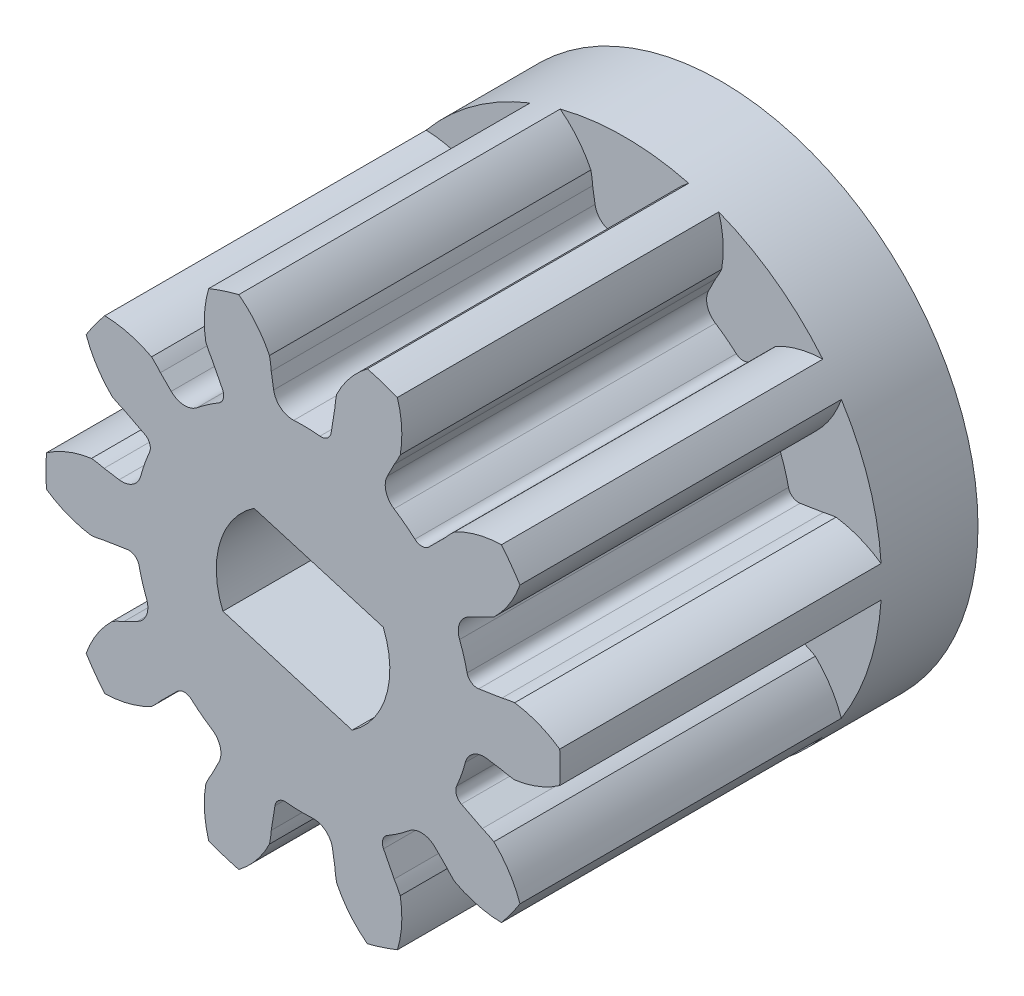
from build123d import *

# Parameters (mm, degrees)
ESBO_O1_R                = 8
RESSALTO_EXTRUS_O1_DEPTH = 13
CORTE_EXTRUS_O1_START    = -10
CORTE_EXTRUS_O1_DEPTH    = 10
PADR_OCIRCULAR1_COUNT    = 10
ESBO_O5_R                = 2.75
CORTE_EXTRUS_O2_DEPTH    = 2.5
FILETE1_R                = 1


with BuildPart() as part:
    # Esboço1 → Ressalto-extrusão1 (new body)
    with BuildSketch(Plane.XY.offset(-62.474592215)):
        with Locations(Location((154.344666384, -4.979841337, 0), (0, 0, 90))):
            Circle(ESBO_O1_R)
        with BuildLine():
            Line((156.839244486, -3.946845648), (152.817363907, -2.753331256))
            ThreePointArc((152.817363907, -2.753331256), (151.756235333, -4.211710693), (151.850088282, -6.012837026))
            Line((151.850088282, -6.012837026), (155.871968862, -7.206351418))
            ThreePointArc((155.871968862, -7.206351418), (156.933097439, -5.747971979), (156.839244486, -3.946845648))
        make_face(mode=Mode.SUBTRACT)
    extrude(amount=RESSALTO_EXTRUS_O1_DEPTH)

    # Esboço4 → Corte-extrusão1 (cut)
    with BuildSketch(Plane.XY.offset(-49.474592215).offset(CORTE_EXTRUS_O1_START)):
        with BuildLine():
            Line((155.259844023, -10.698578623), (155.334666384, -11.166126571))
            ThreePointArc((155.334666384, -11.166126571), (155.355864946, -11.365142474), (155.389666384, -11.562409225))
            ThreePointArc((155.389666384, -11.562409225), (155.798933371, -12.200119109), (156.344666384, -12.725808029))
            ThreePointArc((156.344666384, -12.725808029), (154.344666384, -12.979841337), (152.344666384, -12.725808029))
            ThreePointArc((152.344666384, -12.725808029), (152.890399398, -12.200119109), (153.299666384, -11.562409225))
            ThreePointArc((153.299666384, -11.562409225), (153.333467823, -11.365142474), (153.354666384, -11.166126571))
            Line((153.354666384, -11.166126571), (153.470297344, -10.443574954))
            ThreePointArc((153.470297344, -10.443574954), (153.591194582, -10.240482514), (153.8185158, -10.175769725))
            ThreePointArc((153.8185158, -10.175769725), (154.225958814, -10.20099205), (154.634127125, -10.194313384))
            ThreePointArc((154.634127125, -10.194313384), (155.043877847, -10.326217347), (155.259844023, -10.698578623))
        make_face()
    corte_extrus_o1 = extrude(amount=CORTE_EXTRUS_O1_DEPTH, mode=Mode.SUBTRACT)

    # PadrãoCircular1: Corte-extrusão1 ×10 about axis
    padr_ocircular1_axis = Axis((154.344666384, -4.979841337, 0), (0, 0, 1))
    for i in range(1, PADR_OCIRCULAR1_COUNT):
        add(corte_extrus_o1.rotate(padr_ocircular1_axis, i * 360 / PADR_OCIRCULAR1_COUNT), mode=Mode.SUBTRACT)

    # Esboço5 → Corte-extrusão2 (cut)
    with BuildSketch(Plane(origin=(0, 0, -62.474592215), x_dir=(-1, 0, 0), z_dir=(0, 0, -1))):
        with Locations((-154.344666384, -4.979841337)):
            Circle(ESBO_O5_R)
    extrude(amount=-CORTE_EXTRUS_O2_DEPTH, mode=Mode.SUBTRACT)

    # Filete1
    # the kernel refuses this fillet: 1 mm, written as the material it adds along each edge
    with BuildSketch(Plane(origin=(154.344666384, -4.979841337, -59.974592215), x_dir=(-1, 0, 0), z_dir=(0, -1, 0))) as filete1_piece_1_section:
        with BuildLine():
            CenterArc((2.75 - FILETE1_R, FILETE1_R), FILETE1_R, 270, 90)
            Line((2.75 - FILETE1_R, 0), (2.75, 0))
            Line((2.75, 0), (2.75, FILETE1_R))
        make_face()
    filete1_piece_1 = revolve(axis=Axis((154.344666384, -4.979841337, -59.974592215), (0, 0, -1)), mode=Mode.PRIVATE)
    filete1_piece_1 = filete1_piece_1 - Plane(origin=(154.344666389, -4.979841339, -60.815647373), x_dir=(-0.5656675853449286, 0.8246333627073538, 0), z_dir=(0, 0, -1)) * Cylinder(2.700000004, 12, mode=Mode.PRIVATE)
    add(filete1_piece_1)
    with BuildSketch(Plane(origin=(154.344666384, -4.979841337, -59.974592215), x_dir=(-1, 0, 0), z_dir=(0, -1, 0))) as filete1_piece_2_section:
        with BuildLine():
            CenterArc((2.75 - FILETE1_R, FILETE1_R), FILETE1_R, 270, 90)
            Line((2.75 - FILETE1_R, 0), (2.75, 0))
            Line((2.75, 0), (2.75, FILETE1_R))
        make_face()
    filete1_piece_2 = revolve(axis=Axis((154.344666384, -4.979841337, -59.974592215), (0, 0, -1)), mode=Mode.PRIVATE)
    filete1_piece_2 = split(filete1_piece_2, bisect_by=Plane(origin=(154.828304199, -3.350088453, -60.157362132), z_dir=(0.28449283065041153, 0.9586781677437514, 0)), keep=Keep.TOP, mode=Mode.PRIVATE)
    add(filete1_piece_2)
    with BuildSketch(Plane(origin=(154.344666384, -4.979841337, -59.974592215), x_dir=(-1, 0, 0), z_dir=(0, -1, 0))) as filete1_piece_3_section:
        with BuildLine():
            CenterArc((2.75 - FILETE1_R, FILETE1_R), FILETE1_R, 270, 90)
            Line((2.75 - FILETE1_R, 0), (2.75, 0))
            Line((2.75, 0), (2.75, FILETE1_R))
        make_face()
    filete1_piece_3 = revolve(axis=Axis((154.344666384, -4.979841337, -59.974592215), (0, 0, -1)), mode=Mode.PRIVATE)
    filete1_piece_3 = split(filete1_piece_3, bisect_by=Plane(origin=(152.118883506, -6.092603434, -60.089217232), z_dir=(-0.284492830650411, -0.9586781677437516, 0)), keep=Keep.TOP, mode=Mode.PRIVATE)
    add(filete1_piece_3)


solid = part.part
